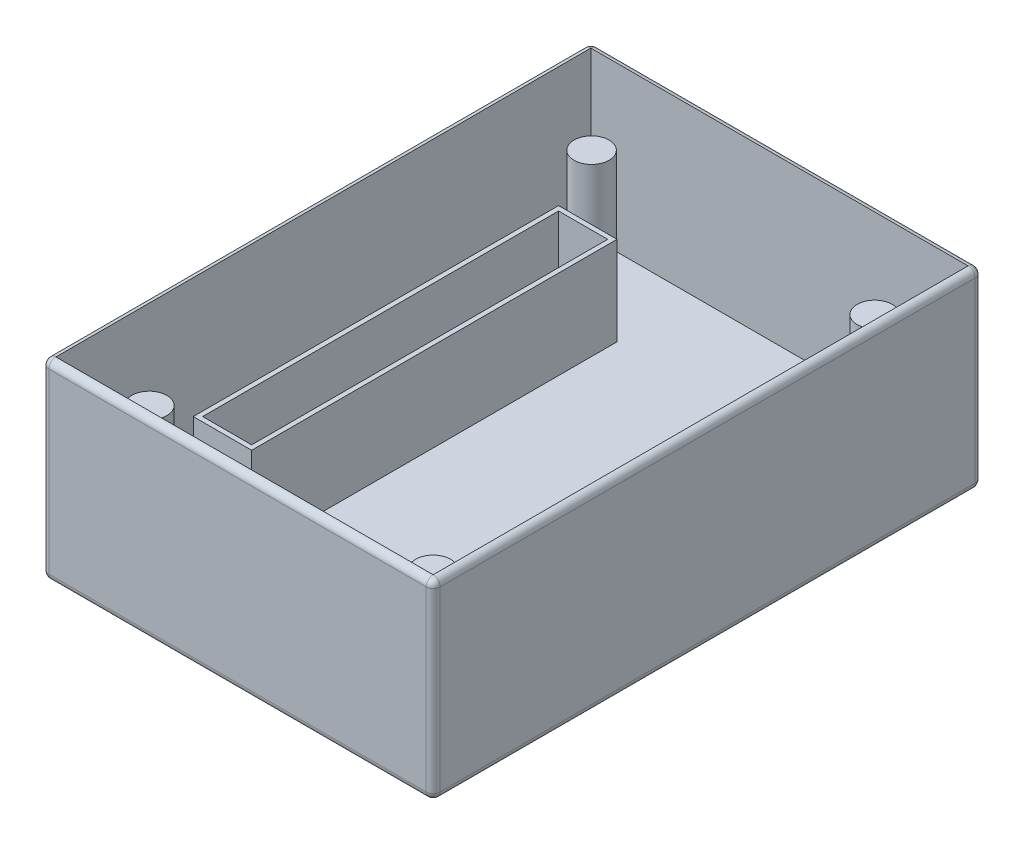
from build123d import *

# Parameters (mm, degrees)
SKETCH1_W           = 16.75
SKETCH1_H           = 23.5
BOSS_EXTRUDE1_DEPTH = 1.2
SKETCH3_R           = 0.75
BOSS_EXTRUDE2_DEPTH = 5.2
SKETCH5_W           = 16.75
SKETCH5_H           = 23.5
SKETCH5_W_2         = 16.15
SKETCH5_H_2         = 22.9
BOSS_EXTRUDE3_DEPTH = 7
SKETCH7_W           = 2.1
SKETCH7_H           = 15.24
BOSS_EXTRUDE5_DEPTH = 3.8
FILLET4_R           = 0.3


with BuildPart() as part:
    # Sketch1 → Boss-Extrude1 (new body)
    with BuildSketch(Plane(origin=(0, 0, 0), x_dir=(1, 0, 0), z_dir=(0, 1, 0))):
        with Locations((8.375, -11.75)):
            Rectangle(SKETCH1_W, SKETCH1_H)
    extrude(amount=BOSS_EXTRUDE1_DEPTH)

    # Sketch3 → Boss-Extrude2 (add)
    with BuildSketch(Plane(origin=(0, 1.2, 0), x_dir=(1, 0, 0), z_dir=(0, 1, 0))):
        with Locations(Location((2.3, -2.268544265, 0), (0, 0, 270))):
            Circle(SKETCH3_R)
        with Locations(Location((2.3, -21.2, 0), (0, 0, 270))):
            Circle(SKETCH3_R)
        with Locations(Location((14.45, -21.2, 0), (0, 0, 270))):
            Circle(SKETCH3_R)
        with Locations(Location((14.45, -2.3, 0), (0, 0, 270))):
            Circle(SKETCH3_R)
    extrude(amount=BOSS_EXTRUDE2_DEPTH)

    # Sketch5 → Boss-Extrude3 (add)
    with BuildSketch(Plane(origin=(0, 1.2, 0), x_dir=(1, 0, 0), z_dir=(0, 1, 0))):
        with Locations((8.375, -11.75)):
            Rectangle(SKETCH5_W, SKETCH5_H)
        with Locations((8.375, -11.75)):
            Rectangle(SKETCH5_W_2, SKETCH5_H_2, mode=Mode.SUBTRACT)
    extrude(amount=BOSS_EXTRUDE3_DEPTH)

    # Sketch7 → Boss-Extrude5 (add)
    with BuildSketch(Plane(origin=(0, 1.2, 0), x_dir=(1, 0, 0), z_dir=(0, 1, 0))):
        Polygon((2.45, -3.63), (4.55, -3.63), (4.75, -3.63), (4.75, -19.27), (2.25, -19.27), (2.25, -3.63), align=None)
        with Locations((3.5, -11.45)):
            Rectangle(SKETCH7_W, SKETCH7_H, mode=Mode.SUBTRACT)
    extrude(amount=BOSS_EXTRUDE5_DEPTH)

    # Fillet4
    fillet4_edges = [part.edges().sort_by_distance(p)[0] for p in [
        (0, 8.2, 11.75),
        (8.375, 8.2, 23.5),
        (16.75, 8.2, 11.75),
        (8.375, 8.2, 0),
        (8.375, 0, 0),
        (16.75, 0, 11.75),
        (8.375, 0, 23.5),
        (0, 0, 11.75),
        (0, 4.1, 0),
        (16.75, 4.1, 0),
        (16.75, 4.1, 23.5),
        (0, 4.1, 23.5),
    ]]
    fillet(fillet4_edges, radius=FILLET4_R - 0.0001)  # a hair under: the kernel refuses the full size


solid = part.part
